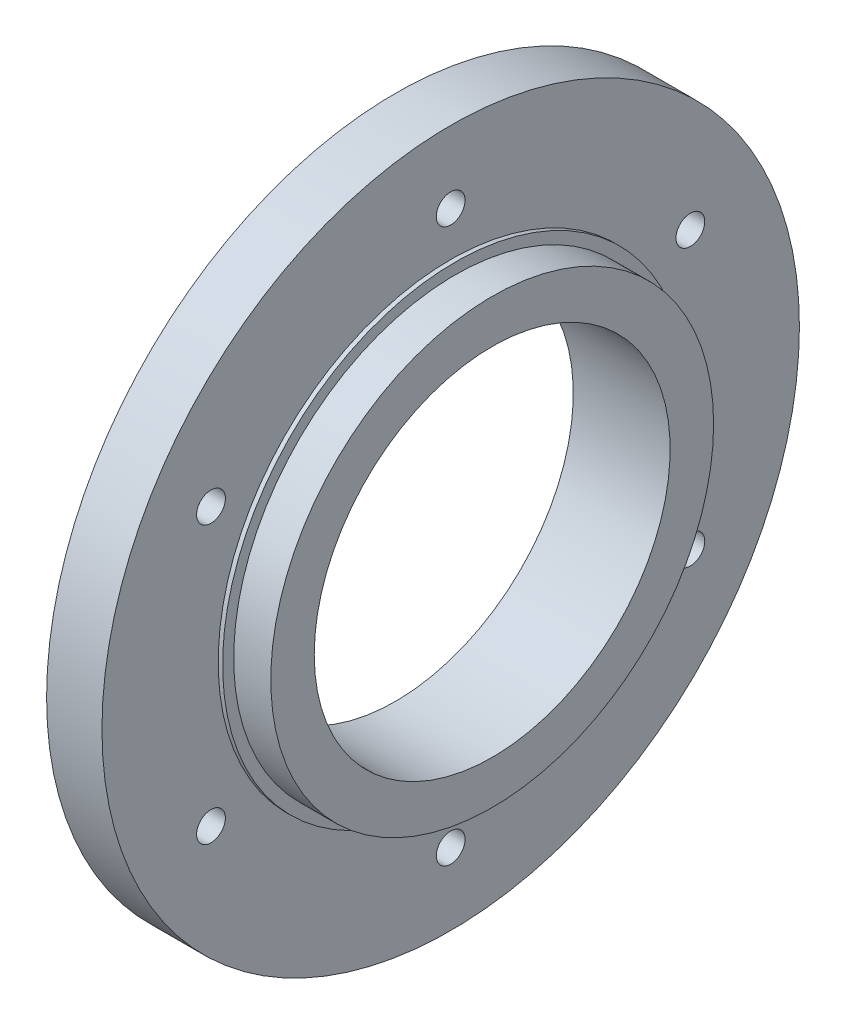
from build123d import *

# Parameters (mm, degrees)
SKIZZE2_R                        = 16.075
SCHNITT_LINEAR_AUSTRAGEN1_DEPTH  = 46.398926199
F_2_6_2_6_DURCHMESSER_BOHRUNG1_D = 2.6
KREISMUSTER2_COUNT               = 6


with BuildPart() as part:
    # Skizze1 → Rotation1 (revolve)
    with BuildSketch(Plane.XY):
        Polygon((0, 0), (0, 31.5), (5, 31.5), (5, 21), (5.4, 21), (5.4, 20), (8.75, 20), (8.75, 0), align=None)
    revolve(axis=Axis((0, 0, 0), (-1, 0, 0)))

    # Skizze2 → Schnitt-Linear austragen1 (cut, through all)
    with BuildSketch(Plane.ZY):
        Circle(SKIZZE2_R)
    extrude(amount=-SCHNITT_LINEAR_AUSTRAGEN1_DEPTH, mode=Mode.SUBTRACT)

    # Ø2.6 (2.6) Durchmesser Bohrung1 (through all)
    with Locations(Plane(origin=(5, 0, 0), x_dir=(0, 0, -1), z_dir=(1, 0, 0))):
        with Locations((0, 25)):
            f_2_6_2_6_durchmesser_bohrung1 = Hole(F_2_6_2_6_DURCHMESSER_BOHRUNG1_D / 2)

    # Kreismuster2: Ø2.6 (2.6) Durchmesser Bohrung1 ×6 about axis
    kreismuster2_axis = Axis((8.75, 0, 0), (-1, 0, 0))
    for i in range(1, KREISMUSTER2_COUNT):
        add(f_2_6_2_6_durchmesser_bohrung1.rotate(kreismuster2_axis, i * 360 / KREISMUSTER2_COUNT), mode=Mode.SUBTRACT)


solid = part.part
